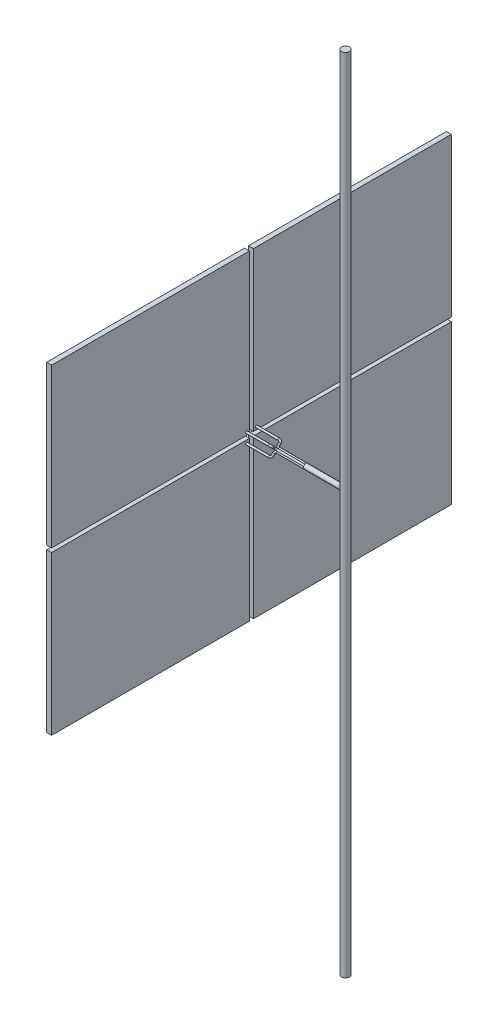
from build123d import *

# Parameters (mm, degrees)
SKETCH_3_W               = 20
SKETCH_3_H               = 16
EXTRUDE_1_DEPTH          = 0.5
EXTRUDE_1_2_DEPTH        = 0.5
EXTRUDE_1_3_DEPTH        = 0.5
EXTRUDE_1_4_DEPTH        = 0.5
SWEEP_4_PROFILE_R        = 0.1
SWEEP_6_PROFILE_R        = 0.25
SWEEP_8_PROFILE_R        = 0.4
MOVE_BODY_3_OUTLINE_R    = 0.1
MOVE_BODY_3_ANGLE        = 90
MOVE_BODY_3_2_OUTLINE_R  = 0.1
MOVE_BODY_3_2_ANGLE      = 90
MOVE_BODY_3_3_OUTLINE_R  = 0.1
MOVE_BODY_3_3_DEPTH      = 2.8000001
MOVE_START               = 0.341421256
MOVE_BODY_3_4_OUTLINE_R  = 0.1
MOVE_BODY_3_4_DEPTH      = 0.165685625
MOVE_START_2             = 3.1999999
MOVE_BODY_3_5_OUTLINE_R  = 0.1
MOVE_BODY_3_5_DEPTH      = 2.8000001
MOVE_BODY_3_6_OUTLINE_R  = 0.1
MOVE_BODY_3_6_ANGLE      = 90
MOVE_BODY_3_7_OUTLINE_R  = 0.1
MOVE_BODY_3_7_ANGLE      = 90
MOVE_BODY_3_8_OUTLINE_R  = 0.1
MOVE_BODY_3_8_DEPTH      = 2.8000001
MOVE_BODY_3_9_OUTLINE_R  = 0.1
MOVE_BODY_3_9_DEPTH      = 0.165685625
MOVE_BODY_3_10_OUTLINE_R = 0.1
MOVE_BODY_3_10_DEPTH     = 2.8000001
MOVE_BODY_3_11_OUTLINE_R = 0.1
MOVE_BODY_3_11_ANGLE     = 90
MOVE_BODY_3_12_OUTLINE_R = 0.1
MOVE_BODY_3_12_ANGLE     = 90
MOVE_BODY_3_13_OUTLINE_R = 0.1
MOVE_BODY_3_13_DEPTH     = 2.8000001
MOVE_START_3             = -0.507106881
MOVE_BODY_3_14_OUTLINE_R = 0.1
MOVE_BODY_3_14_DEPTH     = 0.165685625
MOVE_BODY_3_15_OUTLINE_R = 0.1
MOVE_BODY_3_15_DEPTH     = 2.8000001


with BuildPart() as part:
    # 草图3 → 凸台-拉伸1 (new body)
    with BuildSketch(Plane(origin=(0, 0, 0), x_dir=(0, 0, -1), z_dir=(1, 0, 0))):
        with Locations((10.2, 8.2)):
            Rectangle(SKETCH_3_W, SKETCH_3_H)
    extrude(amount=EXTRUDE_1_DEPTH)


with BuildPart() as body_2:
    # 草图3 → Extrude 1 2 (new body)
    with BuildSketch(Plane(origin=(0, 0, 0), x_dir=(0, 0, -1), z_dir=(1, 0, 0))):
        with Locations((-10.2, -8.2)):
            Rectangle(SKETCH_3_W, SKETCH_3_H)
    extrude(amount=EXTRUDE_1_2_DEPTH)


with BuildPart() as body_3:
    # 草图3 → Extrude 1 3 (new body)
    with BuildSketch(Plane(origin=(0, 0, 0), x_dir=(0, 0, -1), z_dir=(1, 0, 0))):
        with Locations((10.2, -8.2)):
            Rectangle(SKETCH_3_W, SKETCH_3_H)
    extrude(amount=EXTRUDE_1_3_DEPTH)


with BuildPart() as body_4:
    # 草图3 → Extrude 1 4 (new body)
    with BuildSketch(Plane(origin=(0, 0, 0), x_dir=(0, 0, -1), z_dir=(1, 0, 0))):
        with Locations((-10.2, 8.2)):
            Rectangle(SKETCH_3_W, SKETCH_3_H)
    extrude(amount=EXTRUDE_1_4_DEPTH)


with BuildPart() as body_5:
    # 扫描4: sweep along a curve in space
    with BuildLine() as sweep_4_path:
        Line((0, -0.5, 0.5), (2.8, -0.5, 0.5))
        ThreePointArc((2.8, -0.5, 0.5), (2.941421356, -0.458578644, 0.458578644), (3, -0.358578644, 0.358578644))
        Line((3, -0.241421356, 0.241421356), (3, -0.358578644, 0.358578644))
        ThreePointArc((3.2, -0.1, 0.1), (3.058578644, -0.141421356, 0.141421356), (3, -0.241421356, 0.241421356))
        Line((3.2, -0.1, 0.1), (6, -0.1, 0.1))
    # 扫描4 profile (on start of the path) → 扫描4 (sweep)
    with BuildSketch(Plane(origin=(0, -0.5, 0.5), x_dir=(0, 0, 1), z_dir=(1, 0, 0))):
        Circle(SWEEP_4_PROFILE_R)
    sweep(path=sweep_4_path.line)


with BuildPart() as body_6:
    # 扫描6: sweep along a path in 草图31
    with BuildLine(Plane.XY) as sweep_6_path:
        Line((10, 5.5), (10, 0.5))
        ThreePointArc((10, 0.5), (9.85355336, 0.146446579), (9.499999914, 0))
        Line((9.499999914, 0), (6.001497631, 6.02e-07))
    # 扫描6 profile (on start of the path) → 扫描6 (sweep)
    with BuildSketch(Plane(origin=(10, 5.5, 0), x_dir=(0, 0, -1), z_dir=(0, -1, 0))):
        Circle(SWEEP_6_PROFILE_R)
    sweep(path=sweep_6_path.line)


with BuildPart() as body_7:
    # 扫描8: sweep along a path in 草图39
    with BuildLine(Plane.XY) as sweep_8_path:
        Line((10, -42.5), (10, 38.5))
    # 扫描8 profile (on start of the path) → 扫描8 (sweep)
    with BuildSketch(Plane(origin=(10, -42.5, 0), x_dir=(0, 0, 1), z_dir=(0, 1, 0))):
        Circle(SWEEP_8_PROFILE_R)
    sweep(path=sweep_8_path.line)


with BuildPart() as body_8:
    # Move Body 3: read off the stored shape, not the designer's step
    # Move Body 3 outline → Move Body 3 (revolve)
    with BuildSketch(Plane(origin=(2.8, 0.358578644, 0.358578644), x_dir=(0, 0.7071067811865401, 0.7071067811865551), z_dir=(-1, 0, 0))):
        with Locations((0.2, 0)):
            Circle(MOVE_BODY_3_OUTLINE_R)
    revolve(axis=Axis((2.8, 0.358578644, 0.358578644), (0, 0.7071067811865555, -0.7071067811865405)), revolution_arc=MOVE_BODY_3_ANGLE)

    # Move Body 3 2 outline → Move Body 3 2 (revolve)
    with BuildSketch(Plane(origin=(3.2, 0.241421356, 0.241421356), x_dir=(1.3934999695075554e-15, -0.7071067811865401, -0.7071067811865551), z_dir=(1, 0, 0))):
        with Locations((0.2, 0)):
            Circle(MOVE_BODY_3_2_OUTLINE_R)
    revolve(axis=Axis((3.2, 0.241421356, 0.241421356), (0, 0.7071067811865555, -0.7071067811865405)), revolution_arc=MOVE_BODY_3_2_ANGLE)

    # Move Body 3 3 outline → Move Body 3 3 (add)
    with BuildSketch(Plane.YZ):
        with Locations((0.5, 0.5)):
            Circle(MOVE_BODY_3_3_OUTLINE_R)
    extrude(amount=MOVE_BODY_3_3_DEPTH)

    # Move Body 3 4 outline → Move Body 3 4 (add)
    with BuildSketch(Plane(origin=(0, 0, 0), x_dir=(1, 0, 0), z_dir=(0, 0.70710678118654, 0.707106781186555)).offset(MOVE_START)):
        with Locations((3, 0)):
            Circle(MOVE_BODY_3_4_OUTLINE_R)
    extrude(amount=MOVE_BODY_3_4_DEPTH)

    # Move Body 3 5 outline → Move Body 3 5 (add)
    with BuildSketch(Plane.YZ.offset(MOVE_START_2)):
        with Locations((0.1, 0.1)):
            Circle(MOVE_BODY_3_5_OUTLINE_R)
    extrude(amount=MOVE_BODY_3_5_DEPTH)


with BuildPart() as body_9:
    # Move Body 3 6 outline → Move Body 3 6 (revolve)
    with BuildSketch(Plane(origin=(2.8, 0.358578644, -0.358578644), x_dir=(1, 0, 0), z_dir=(0, -0.707106781186552, 0.707106781186543))):
        with Locations((0.2, 0)):
            Circle(MOVE_BODY_3_6_OUTLINE_R)
    revolve(axis=Axis((2.8, 0.358578644, -0.358578644), (0, 0.707106781186543, 0.707106781186552)), revolution_arc=MOVE_BODY_3_6_ANGLE)

    # Move Body 3 7 outline → Move Body 3 7 (revolve)
    with BuildSketch(Plane(origin=(3.2, 0.241421356, -0.241421356), x_dir=(-1, 0, 0), z_dir=(-1.0106430996148604e-15, 0.707106781186552, -0.707106781186543))):
        with Locations((0.2, 0)):
            Circle(MOVE_BODY_3_7_OUTLINE_R)
    revolve(axis=Axis((3.2, 0.241421356, -0.241421356), (0, 0.707106781186543, 0.707106781186552)), revolution_arc=MOVE_BODY_3_7_ANGLE)

    # Move Body 3 8 outline → Move Body 3 8 (add)
    with BuildSketch(Plane.YZ):
        with Locations((0.5, -0.5)):
            Circle(MOVE_BODY_3_8_OUTLINE_R)
    extrude(amount=MOVE_BODY_3_8_DEPTH)

    # Move Body 3 9 outline → Move Body 3 9 (add)
    with BuildSketch(Plane(origin=(0, 0, 0), x_dir=(1, 0, 0), z_dir=(0, 0.707106781186552, -0.707106781186543)).offset(MOVE_START)):
        with Locations((3, 0)):
            Circle(MOVE_BODY_3_9_OUTLINE_R)
    extrude(amount=MOVE_BODY_3_9_DEPTH)

    # Move Body 3 10 outline → Move Body 3 10 (add)
    with BuildSketch(Plane.YZ.offset(MOVE_START_2)):
        with Locations((0.1, -0.1)):
            Circle(MOVE_BODY_3_10_OUTLINE_R)
    extrude(amount=MOVE_BODY_3_10_DEPTH)


with BuildPart() as body_10:
    # Move Body 3 11 outline → Move Body 3 11 (revolve)
    with BuildSketch(Plane(origin=(2.8, -0.358578644, -0.358578644), x_dir=(1, 0, 0), z_dir=(0, 0.707106781186545, 0.70710678118655))):
        with Locations((0.2, 0)):
            Circle(MOVE_BODY_3_11_OUTLINE_R)
    revolve(axis=Axis((2.8, -0.358578644, -0.358578644), (0, 0.70710678118655, -0.707106781186545)), revolution_arc=MOVE_BODY_3_11_ANGLE)

    # Move Body 3 12 outline → Move Body 3 12 (revolve)
    with BuildSketch(Plane(origin=(3.2, -0.241421356, -0.241421356), x_dir=(-1, 0, 0), z_dir=(-1.0106430996148606e-15, -0.707106781186545, -0.70710678118655))):
        with Locations((0.2, 0)):
            Circle(MOVE_BODY_3_12_OUTLINE_R)
    revolve(axis=Axis((3.2, -0.241421356, -0.241421356), (0, 0.70710678118655, -0.707106781186545)), revolution_arc=MOVE_BODY_3_12_ANGLE)

    # Move Body 3 13 outline → Move Body 3 13 (add)
    with BuildSketch(Plane.YZ):
        with Locations((-0.5, -0.5)):
            Circle(MOVE_BODY_3_13_OUTLINE_R)
    extrude(amount=MOVE_BODY_3_13_DEPTH)

    # Move Body 3 14 outline → Move Body 3 14 (add)
    with BuildSketch(Plane(origin=(0, 0, 0), x_dir=(1, 0, 0), z_dir=(0, 0.707106781186545, 0.70710678118655)).offset(MOVE_START_3)):
        with Locations((3, 0)):
            Circle(MOVE_BODY_3_14_OUTLINE_R)
    extrude(amount=MOVE_BODY_3_14_DEPTH)

    # Move Body 3 15 outline → Move Body 3 15 (add)
    with BuildSketch(Plane.YZ.offset(MOVE_START_2)):
        with Locations((-0.1, -0.1)):
            Circle(MOVE_BODY_3_15_OUTLINE_R)
    extrude(amount=MOVE_BODY_3_15_DEPTH)


solid = Compound([part.part, body_2.part, body_3.part, body_4.part, body_5.part, body_6.part, body_7.part, body_8.part, body_9.part, body_10.part])
